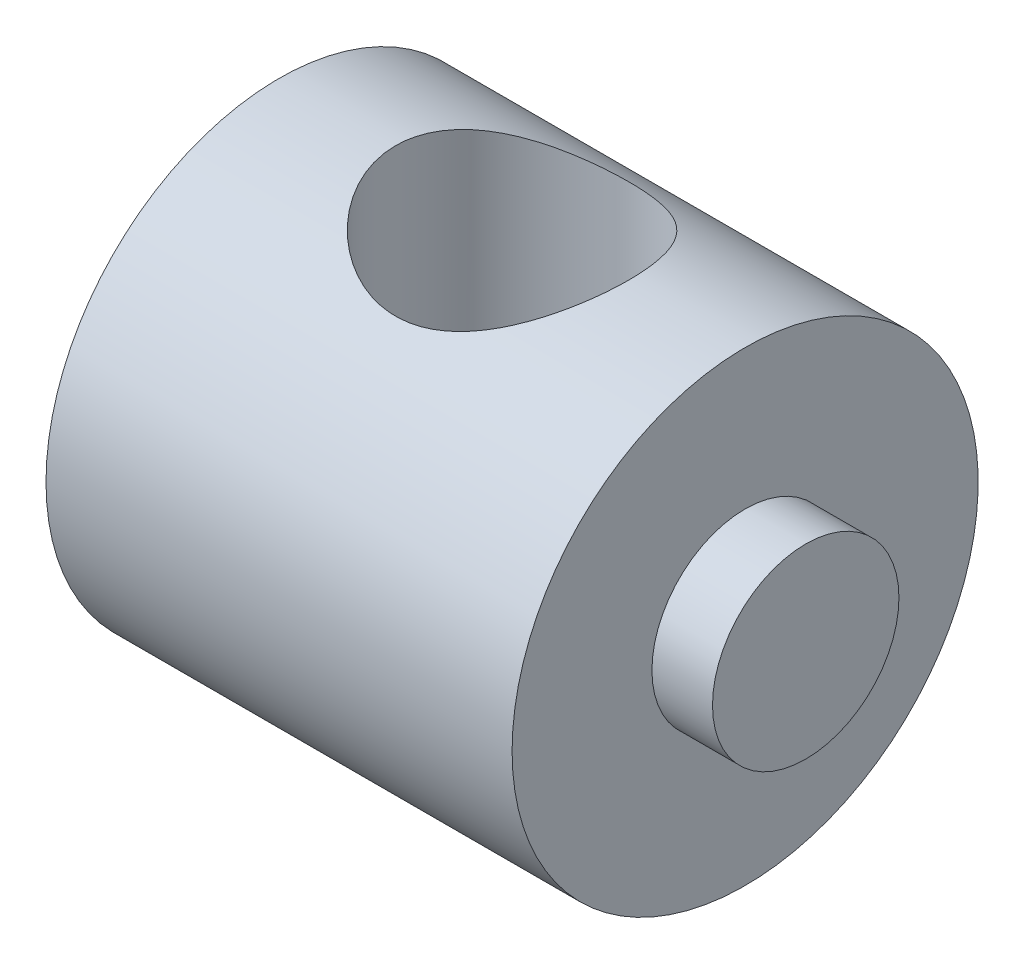
from build123d import *

# Parameters (mm, degrees)
CUT_EXTRUDE1_DEPTH      = 14
CUT_EXTRUDE1_DEPTH_BACK = 14
SKETCH2_R               = 5
SKETCH3_R               = 6.98958948
SKETCH3_R_2             = 5
BOSS_EXTRUDE1_DEPTH     = 10
SKETCH6_W               = 20
SKETCH6_H               = 4.563711108


with BuildPart() as part:
    # Sketch1 → Revolve1 (revolve)
    with BuildSketch(Plane.XY):
        Polygon((0, 0), (0, 4), (2.6, 4), (2.6, 10), (22.6, 10), (22.6, 4), (25.2, 4), (25.2, 0), align=None)
    revolve(axis=Axis((0, 0, 0), (1, 0, 0)))

    # Sketch2 → Cut-Extrude1 (cut, two sides: drawn at the far end of the back side and taken through both)
    with BuildSketch(Plane(origin=(0, 0, 0), x_dir=(1, 0, 0), z_dir=(0, 1, 0)).offset(-CUT_EXTRUDE1_DEPTH_BACK)):
        with Locations((12.6, 0)):
            Circle(SKETCH2_R)
    extrude(amount=CUT_EXTRUDE1_DEPTH + CUT_EXTRUDE1_DEPTH_BACK, mode=Mode.SUBTRACT)

    # Sketch3 → Boss-Extrude1 (add, symmetric)
    with BuildSketch(Plane(origin=(0, 0, 0), x_dir=(1, 0, 0), z_dir=(0, 1, 0))):
        with Locations((12.6, 0)):
            Circle(SKETCH3_R)
        with Locations((12.6, 0)):
            Circle(SKETCH3_R_2, mode=Mode.SUBTRACT)
    extrude(amount=BOSS_EXTRUDE1_DEPTH, both=True)

    # Sketch6 → Cut-Revolve1 (revolve, cut)
    with BuildSketch(Plane.XY):
        with Locations((12.6, 12.281855554)):
            Rectangle(SKETCH6_W, SKETCH6_H)
    revolve(axis=Axis((0, 0, 0), (1, 0, 0)), mode=Mode.SUBTRACT)


solid = part.part
